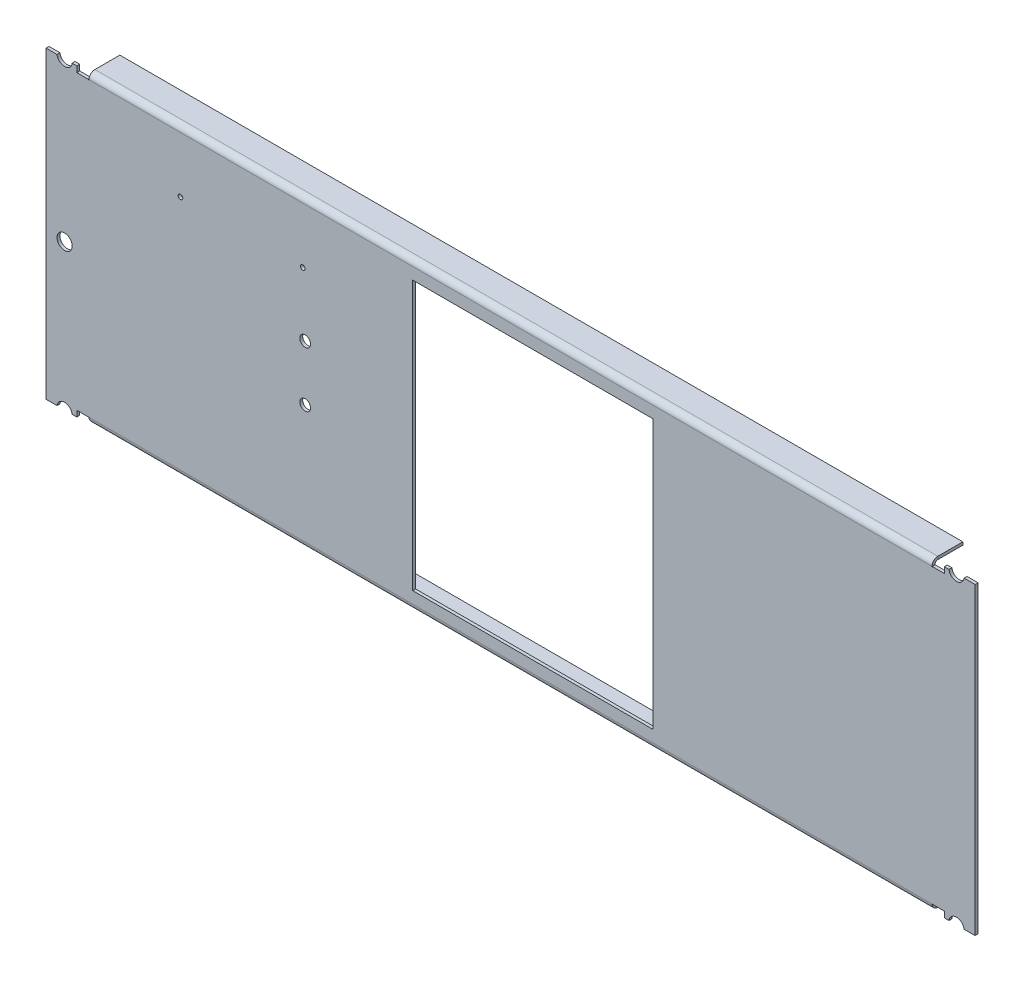
from build123d import *

# Parameters (mm, degrees)
CROQUIS1_W                   = 482.6
CROQUIS1_H                   = 157.988
BRIDA_BASE1_DEPTH            = 1.524
CROQUIS6_R                   = 3.9624
CROQUIS6_W                   = 6.35
CROQUIS6_H                   = 3.048
CORTAR_EXTRUIR1_DEPTH        = 254.905621466
BRIDA_START                  = -218.948
BRIDA_DE_ARISTA1_DEPTH       = 437.896
BRIDA_START_2                = -219.1004
BRIDA_DE_ARISTA1_2_OUTLINE_W = 0.1524
BRIDA_DE_ARISTA1_2_OUTLINE_H = 1.524
BRIDA_DE_ARISTA1_2_DEPTH     = 0.1524
BRIDA_START_3                = 218.948
BRIDA_DE_ARISTA1_3_OUTLINE_W = 0.1524
BRIDA_DE_ARISTA1_3_OUTLINE_H = 1.524
BRIDA_DE_ARISTA1_3_DEPTH     = 0.1524
BRIDA_DE_ARISTA1_4_DEPTH     = 437.896
CROQUIS13_R                  = 2.794
CROQUIS13_R_2                = 1.2065
CROQUIS13_R_3                = 3.937
CROQUIS13_W                  = 124.714
CROQUIS13_H                  = 139.7
CORTAR_EXTRUIR2_DEPTH        = 27.178


# Read off the part's stored shape, not the designer's step: Brida de arista1
# Sheet-metal steps are written as plain solids
with BuildPart() as part:
    # Croquis1 → Brida base1 (new body)
    with BuildSketch(Plane.XY):
        Rectangle(CROQUIS1_W, CROQUIS1_H)
    extrude(amount=-BRIDA_BASE1_DEPTH)

    # Croquis6 → Cortar-Extruir1 (cut, through all)
    with BuildSketch(Plane.XY):
        with Locations((231.648, 79.502)):
            Circle(CROQUIS6_R)
        with Locations((-231.648, 79.502)):
            Circle(CROQUIS6_R)
        with Locations((-231.648, -79.502)):
            Circle(CROQUIS6_R)
        with Locations((231.648, -79.502)):
            Circle(CROQUIS6_R)
        with Locations((-222.123, 77.47)):
            Rectangle(CROQUIS6_W, CROQUIS6_H)
        with Locations((222.123, 77.47)):
            Rectangle(CROQUIS6_W, CROQUIS6_H)
        with Locations((-222.123, -77.47)):
            Rectangle(CROQUIS6_W, CROQUIS6_H)
        with Locations((222.123, -77.47)):
            Rectangle(CROQUIS6_W, CROQUIS6_H)
    extrude(amount=-CORTAR_EXTRUIR1_DEPTH, mode=Mode.SUBTRACT)

    # Brida de arista1 outline → Brida de arista1 (cut)
    with BuildSketch(Plane.YZ.offset(BRIDA_START)):
        with BuildLine():
            ThreePointArc((-78.585645431, -1.524), (-77.47, -0.408354569), (-75.946, 0))
            Line((-75.946, 0), (-78.994, 0))
            Line((-78.994, 0), (-78.994, -1.524))
            Line((-78.994, -1.524), (-78.585645431, -1.524))
        make_face()
        with BuildLine():
            Line((78.994, 0), (75.946, 0))
            ThreePointArc((75.946, 0), (77.47, -0.408354569), (78.585645431, -1.524))
            Line((78.585645431, -1.524), (78.994, -1.524))
            Line((78.994, -1.524), (78.994, 0))
        make_face()
    extrude(amount=BRIDA_DE_ARISTA1_DEPTH, mode=Mode.SUBTRACT)

    # Brida de arista1 2 outline → Brida de arista1 2 (cut)
    with BuildSketch(Plane.YZ.offset(BRIDA_START_2)):
        with Locations((-75.8698, -0.762)):
            Rectangle(BRIDA_DE_ARISTA1_2_OUTLINE_W, BRIDA_DE_ARISTA1_2_OUTLINE_H)
        with Locations((75.8698, -0.762)):
            Rectangle(BRIDA_DE_ARISTA1_2_OUTLINE_W, BRIDA_DE_ARISTA1_2_OUTLINE_H)
    extrude(amount=BRIDA_DE_ARISTA1_2_DEPTH, mode=Mode.SUBTRACT)

    # Brida de arista1 3 outline → Brida de arista1 3 (cut)
    with BuildSketch(Plane.YZ.offset(BRIDA_START_3)):
        with Locations((-75.8698, -0.762)):
            Rectangle(BRIDA_DE_ARISTA1_3_OUTLINE_W, BRIDA_DE_ARISTA1_3_OUTLINE_H)
        with Locations((75.8698, -0.762)):
            Rectangle(BRIDA_DE_ARISTA1_3_OUTLINE_W, BRIDA_DE_ARISTA1_3_OUTLINE_H)
    extrude(amount=BRIDA_DE_ARISTA1_3_DEPTH, mode=Mode.SUBTRACT)

    # Brida de arista1 4 outline → Brida de arista1 4 (add)
    with BuildSketch(Plane.YZ.offset(BRIDA_START)):
        with BuildLine():
            ThreePointArc((-77.47, -3.048), (-77.023630735, -1.970369265), (-75.946, -1.524))
            Line((-75.946, -1.524), (-78.585645431, -1.524))
            ThreePointArc((-78.585645431, -1.524), (-78.890141918, -2.259119551), (-78.994, -3.048))
            Line((-78.994, -3.048), (-78.994, -16.002))
            Line((-78.994, -16.002), (-77.47, -16.002))
            Line((-77.47, -16.002), (-77.47, -3.048))
        make_face()
        with BuildLine():
            Line((78.585645431, -1.524), (75.946, -1.524))
            ThreePointArc((75.946, -1.524), (77.023630735, -1.970369265), (77.47, -3.048))
            Line((77.47, -3.048), (77.47, -16.002))
            Line((77.47, -16.002), (78.994, -16.002))
            Line((78.994, -16.002), (78.994, -3.048))
            ThreePointArc((78.994, -3.048), (78.890141918, -2.259119551), (78.585645431, -1.524))
        make_face()
    extrude(amount=BRIDA_DE_ARISTA1_4_DEPTH)

    # Croquis13 → Cortar-Extruir2 (cut)
    with BuildSketch(Plane.XY):
        with Locations((-106.68, 14.478)):
            Circle(CROQUIS13_R)
        with Locations((-106.68, -14.224)):
            Circle(CROQUIS13_R)
        with Locations((-107.95, 46.99)):
            Circle(CROQUIS13_R_2)
        with Locations((-171.45, 46.99)):
            Circle(CROQUIS13_R_2)
        with Locations((-231.648, -3.302)):
            Circle(CROQUIS13_R_3)
        with Locations((11.557, 0)):
            Rectangle(CROQUIS13_W, CROQUIS13_H)
    extrude(amount=-CORTAR_EXTRUIR2_DEPTH, mode=Mode.SUBTRACT)


solid = part.part
